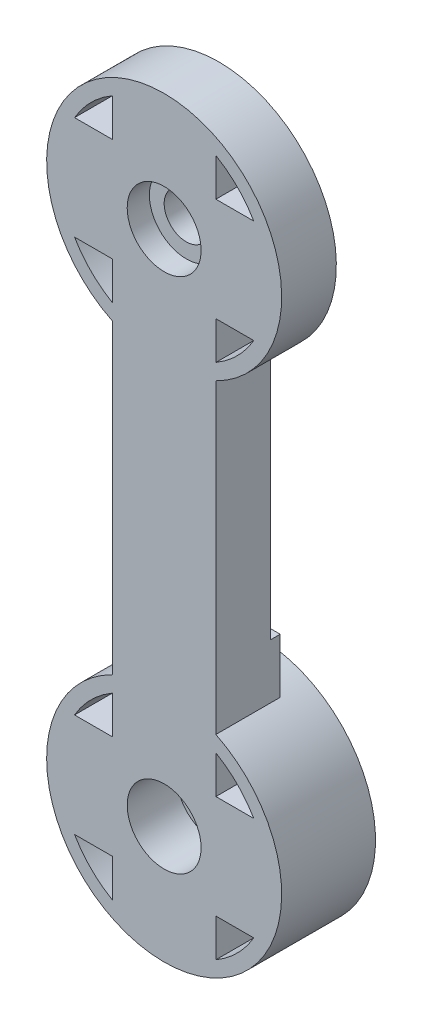
from build123d import *
from build123d.topology import SkipClean

# Parameters (mm, degrees)
SKETCH1_R               = 1.5
BOSS_EXTRUDE4_DEPTH     = 3
BOSS_EXTRUDE5_START     = 3
SKETCH3_R               = 7.95
SKETCH3_R_2             = 1.5
BOSS_EXTRUDE5_DEPTH     = 3
SKETCH4_R               = 2.5
CUT_EXTRUDE1_DEPTH      = 1.5
SKETCH5_R               = 7
CUT_EXTRUDE2_DEPTH      = 2
SKETCH6_R               = 7.95
CUT_EXTRUDE3_DEPTH      = 1
SKETCH7_R               = 2.5
CUT_EXTRUDE4_DEPTH      = 1.85
BOSS_EXTRUDE6_START     = 0.7
SKETCH8_R               = 7.95
SKETCH8_R_2             = 7
BOSS_EXTRUDE6_DEPTH     = 0.7
BOSS_EXTRUDE8_START     = 0.7
SKETCH9_R               = 7.95
SKETCH9_R_2             = 1.5
BOSS_EXTRUDE8_DEPTH     = 0.7
BOSS_EXTRUDE9_START     = 0.7
BOSS_EXTRUDE9_DEPTH     = 0.7
CUT_EXTRUDE5_DEPTH      = 45.603755447
CUT_EXTRUDE5_DEPTH_BACK = 45.603755447
SKETCH11_W              = 3
SKETCH11_H              = 15.9
SKETCH11_W_2            = 2
BOSS_EXTRUDE10_START    = 0.65
BOSS_EXTRUDE10_DEPTH    = 0.65
BOSS_EXTRUDE11_START    = 2.65
SKETCH13_R              = 7.95
SKETCH13_R_2            = 1.5
BOSS_EXTRUDE11_DEPTH    = 2.65


with BuildPart() as part:
    # Sketch1 → Boss-Extrude4 (new body)
    with BuildSketch(Plane.XY):
        with BuildLine():
            Line((-3.5, -7.138101989), (-3.5, -27.861898011))
            ThreePointArc((-3.5, -27.861898011), (0, -42.95), (3.5, -27.861898011))
            Line((3.5, -27.861898011), (3.5, -7.138101989))
            ThreePointArc((3.5, -7.138101989), (0, 7.95), (-3.5, -7.138101989))
        make_face()
        with BuildLine():
            Line((-3.5, 6.062177826), (-3.5, 3.5))
            Line((-3.5, 3.5), (-6.062177826, 3.5))
            ThreePointArc((-6.062177826, 3.5), (-4.949747468, 4.949747468), (-3.5, 6.062177826))
        make_face(mode=Mode.SUBTRACT)
        with BuildLine():
            Line((3.5, 3.5), (3.5, 6.062177826))
            ThreePointArc((3.5, 6.062177826), (4.949747468, 4.949747468), (6.062177826, 3.5))
            Line((6.062177826, 3.5), (3.5, 3.5))
        make_face(mode=Mode.SUBTRACT)
        Circle(SKETCH1_R, mode=Mode.SUBTRACT)
        with BuildLine():
            Line((-6.062177826, -3.5), (-3.5, -3.5))
            Line((-3.5, -3.5), (-3.5, -6.062177826))
            ThreePointArc((-3.5, -6.062177826), (-4.949747468, -4.949747468), (-6.062177826, -3.5))
        make_face(mode=Mode.SUBTRACT)
        with BuildLine():
            Line((3.5, -3.5), (6.062177826, -3.5))
            ThreePointArc((6.062177826, -3.5), (4.949747468, -4.949747468), (3.5, -6.062177826))
            Line((3.5, -6.062177826), (3.5, -3.5))
        make_face(mode=Mode.SUBTRACT)
        with BuildLine():
            ThreePointArc((3.5, -28.937822174), (4.949747468, -30.050252532), (6.062177826, -31.5))
            Line((6.062177826, -31.5), (3.5, -31.5))
            Line((3.5, -31.5), (3.5, -28.937822174))
        make_face(mode=Mode.SUBTRACT)
        with BuildLine():
            Line((-3.5, -28.937822174), (-3.5, -31.5))
            Line((-3.5, -31.5), (-6.062177826, -31.5))
            ThreePointArc((-6.062177826, -31.5), (-4.949747468, -30.050252532), (-3.5, -28.937822174))
        make_face(mode=Mode.SUBTRACT)
        with BuildLine():
            ThreePointArc((-3.5, -41.062177826), (-4.949747468, -39.949747468), (-6.062177826, -38.5))
            Line((-6.062177826, -38.5), (-3.5, -38.5))
            Line((-3.5, -38.5), (-3.5, -41.062177826))
        make_face(mode=Mode.SUBTRACT)
        with BuildLine():
            ThreePointArc((6.062177826, -38.5), (4.949747468, -39.949747468), (3.5, -41.062177826))
            Line((3.5, -41.062177826), (3.5, -38.5))
            Line((3.5, -38.5), (6.062177826, -38.5))
        make_face(mode=Mode.SUBTRACT)
        with Locations((0, -35)):
            Circle(SKETCH1_R, mode=Mode.SUBTRACT)
    extrude(amount=BOSS_EXTRUDE4_DEPTH)

    # Sketch3 → Boss-Extrude5 (add)
    # profile 1 of 2: a face of its own
    with SkipClean():  # the faces are left unmerged after this step: merging them gives an invalid solid
        with BuildSketch(Plane(origin=(0, 0, 0), x_dir=(-1, 0, 0), z_dir=(0, 0, -1)).offset(BOSS_EXTRUDE5_START)):
            Circle(SKETCH3_R)
            with BuildLine():
                Line((3.5, 3.5), (3.5, 6.062177826))
                ThreePointArc((3.5, 6.062177826), (4.949747468, 4.949747468), (6.062177826, 3.5))
                Line((6.062177826, 3.5), (3.5, 3.5))
            make_face(mode=Mode.SUBTRACT)
            with BuildLine():
                Line((3.5, -3.5), (6.062177826, -3.5))
                ThreePointArc((6.062177826, -3.5), (4.949747468, -4.949747468), (3.5, -6.062177826))
                Line((3.5, -6.062177826), (3.5, -3.5))
            make_face(mode=Mode.SUBTRACT)
            with BuildLine():
                Line((-3.5, -3.5), (-3.5, -6.062177826))
                ThreePointArc((-3.5, -6.062177826), (-4.949747468, -4.949747468), (-6.062177826, -3.5))
                Line((-6.062177826, -3.5), (-3.5, -3.5))
            make_face(mode=Mode.SUBTRACT)
            with BuildLine():
                Line((-3.5, 3.5), (-6.062177826, 3.5))
                ThreePointArc((-6.062177826, 3.5), (-4.949747468, 4.949747468), (-3.5, 6.062177826))
                Line((-3.5, 6.062177826), (-3.5, 3.5))
            make_face(mode=Mode.SUBTRACT)
            Circle(SKETCH3_R_2, mode=Mode.SUBTRACT)
        # profile 2 of 2: a face of its own
        with BuildSketch(Plane(origin=(0, 0, 0), x_dir=(-1, 0, 0), z_dir=(0, 0, -1)).offset(BOSS_EXTRUDE5_START)):
            with Locations((0, -35)):
                Circle(SKETCH3_R)
            with BuildLine():
                Line((-3.5, -38.5), (-3.5, -41.062177826))
                ThreePointArc((-3.5, -41.062177826), (-4.949747468, -39.949747468), (-6.062177826, -38.5))
                Line((-6.062177826, -38.5), (-3.5, -38.5))
            make_face(mode=Mode.SUBTRACT)
            with BuildLine():
                Line((-3.5, -31.5), (-6.062177826, -31.5))
                ThreePointArc((-6.062177826, -31.5), (-4.949747468, -30.050252532), (-3.5, -28.937822174))
                Line((-3.5, -28.937822174), (-3.5, -31.5))
            make_face(mode=Mode.SUBTRACT)
            with BuildLine():
                Line((3.5, -31.5), (3.5, -28.937822174))
                ThreePointArc((3.5, -28.937822174), (4.949747468, -30.050252532), (6.062177826, -31.5))
                Line((6.062177826, -31.5), (3.5, -31.5))
            make_face(mode=Mode.SUBTRACT)
            with BuildLine():
                Line((3.5, -38.5), (6.062177826, -38.5))
                ThreePointArc((6.062177826, -38.5), (4.949747468, -39.949747468), (3.5, -41.062177826))
                Line((3.5, -41.062177826), (3.5, -38.5))
            make_face(mode=Mode.SUBTRACT)
            with Locations((0, -35)):
                Circle(SKETCH3_R_2, mode=Mode.SUBTRACT)
        extrude(amount=-BOSS_EXTRUDE5_DEPTH)

    # Sketch4 → Cut-Extrude1 (cut)
    with SkipClean():  # the faces are left unmerged after this step: merging them gives an invalid solid
        with BuildSketch(Plane.XY.offset(3)):
            with Locations((0, -35)):
                Circle(SKETCH4_R)
            Circle(SKETCH4_R)
        extrude(amount=-CUT_EXTRUDE1_DEPTH, mode=Mode.SUBTRACT)

    # Sketch5 → Cut-Extrude2 (cut)
    with SkipClean():  # the faces are left unmerged after this step: merging them gives an invalid solid
        with BuildSketch(Plane(origin=(0, 0, -3), x_dir=(-1, 0, 0), z_dir=(0, 0, -1))):
            Circle(SKETCH5_R)
        extrude(amount=-CUT_EXTRUDE2_DEPTH, mode=Mode.SUBTRACT)

    # Sketch6 → Cut-Extrude3 (cut)
    with SkipClean():  # the faces are left unmerged after this step: merging them gives an invalid solid
        with BuildSketch(Plane(origin=(0, 0, -3), x_dir=(-1, 0, 0), z_dir=(0, 0, -1))):
            with Locations((0, -35)):
                Circle(SKETCH6_R)
        extrude(amount=-CUT_EXTRUDE3_DEPTH, mode=Mode.SUBTRACT)

    # Sketch7 → Cut-Extrude4 (cut)
    with SkipClean():  # the faces are left unmerged after this step: merging them gives an invalid solid
        with BuildSketch(Plane.XY.offset(1.5)):
            with Locations((0, -35)):
                Circle(SKETCH7_R)
        extrude(amount=-CUT_EXTRUDE4_DEPTH, mode=Mode.SUBTRACT)

    # Sketch8 → Boss-Extrude6 (add)
    with BuildSketch(Plane(origin=(0, 0, -3), x_dir=(-1, 0, 0), z_dir=(0, 0, -1)).offset(BOSS_EXTRUDE6_START)):
        Circle(SKETCH8_R)
        Circle(SKETCH8_R_2, mode=Mode.SUBTRACT)
    extrude(amount=-BOSS_EXTRUDE6_DEPTH)

    # Sketch9 → Boss-Extrude8 (add)
    with SkipClean():  # the faces are left unmerged after this step: merging them gives an invalid solid
        with BuildSketch(Plane(origin=(0, 0, -2), x_dir=(-1, 0, 0), z_dir=(0, 0, -1)).offset(BOSS_EXTRUDE8_START)):
            with Locations((0, -35)):
                Circle(SKETCH9_R)
            with BuildLine():
                Line((3.5, -31.5), (3.5, -28.937822174))
                ThreePointArc((3.5, -28.937822174), (4.949747468, -30.050252532), (6.062177826, -31.5))
                Line((6.062177826, -31.5), (3.5, -31.5))
            make_face(mode=Mode.SUBTRACT)
            with BuildLine():
                Line((3.5, -38.5), (6.062177826, -38.5))
                ThreePointArc((6.062177826, -38.5), (4.949747468, -39.949747468), (3.5, -41.062177826))
                Line((3.5, -41.062177826), (3.5, -38.5))
            make_face(mode=Mode.SUBTRACT)
            with BuildLine():
                Line((-3.5, -38.5), (-3.5, -41.062177826))
                ThreePointArc((-3.5, -41.062177826), (-4.949747468, -39.949747468), (-6.062177826, -38.5))
                Line((-6.062177826, -38.5), (-3.5, -38.5))
            make_face(mode=Mode.SUBTRACT)
            with BuildLine():
                Line((-3.5, -31.5), (-6.062177826, -31.5))
                ThreePointArc((-6.062177826, -31.5), (-4.949747468, -30.050252532), (-3.5, -28.937822174))
                Line((-3.5, -28.937822174), (-3.5, -31.5))
            make_face(mode=Mode.SUBTRACT)
            with Locations((0, -35)):
                Circle(SKETCH9_R_2, mode=Mode.SUBTRACT)
        extrude(amount=-BOSS_EXTRUDE8_DEPTH)

    # Sketch10 → Boss-Extrude9 (add)
    with SkipClean():  # the faces are left unmerged after this step: merging them gives an invalid solid
        with BuildSketch(Plane(origin=(0, 0, 0), x_dir=(-1, 0, 0), z_dir=(0, 0, -1)).offset(BOSS_EXTRUDE9_START)):
            with BuildLine():
                ThreePointArc((3.5, -7.138101989), (0, -7.95), (-3.5, -7.138101989))
                Line((-3.5, -7.138101989), (-3.5, -27.861898011))
                ThreePointArc((-3.5, -27.861898011), (0, -27.05), (3.5, -27.861898011))
                Line((3.5, -27.861898011), (3.5, -7.138101989))
            make_face()
        extrude(amount=-BOSS_EXTRUDE9_DEPTH)

    # Sketch11 → Cut-Extrude5 (cut, two sides: drawn at the far end of the back side and taken through both)
    with SkipClean():  # the faces are left unmerged after this step: merging them gives an invalid solid
        with BuildSketch(Plane(origin=(3.5, 0, 0), x_dir=(0, 0, -1), z_dir=(1, 0, 0)).offset(-CUT_EXTRUDE5_DEPTH_BACK)):
            with Locations((2.2, 0)):
                Rectangle(SKETCH11_W, SKETCH11_H)
            with Locations((1.7, -35)):
                Rectangle(SKETCH11_W_2, SKETCH11_H)
        extrude(amount=CUT_EXTRUDE5_DEPTH + CUT_EXTRUDE5_DEPTH_BACK, mode=Mode.SUBTRACT)

    # Sketch12 → Boss-Extrude10 (add)
    with SkipClean():  # the faces are left unmerged after this step: merging them gives an invalid solid
        with BuildSketch(Plane(origin=(0, 0, -0.7), x_dir=(-1, 0, 0), z_dir=(0, 0, -1)).offset(BOSS_EXTRUDE10_START)):
            with BuildLine():
                Line((-3.5, -24.161898011), (-3.5, -27.861898011))
                ThreePointArc((-3.5, -27.861898011), (0, -27.05), (3.5, -27.861898011))
                Line((3.5, -27.861898011), (3.5, -24.161898011))
                Line((3.5, -24.161898011), (-3.5, -24.161898011))
            make_face()
        extrude(amount=-BOSS_EXTRUDE10_DEPTH)

    # Sketch13 → Boss-Extrude11 (add)
    with SkipClean():  # the faces are left unmerged after this step: merging them gives an invalid solid
        with BuildSketch(Plane(origin=(0, 0, -0.7), x_dir=(-1, 0, 0), z_dir=(0, 0, -1)).offset(BOSS_EXTRUDE11_START)):
            with Locations((0, -35)):
                Circle(SKETCH13_R)
            with BuildLine():
                Line((-3.5, -31.5), (-6.062177826, -31.5))
                ThreePointArc((-6.062177826, -31.5), (-4.949747468, -30.050252532), (-3.5, -28.937822174))
                Line((-3.5, -28.937822174), (-3.5, -31.5))
            make_face(mode=Mode.SUBTRACT)
            with BuildLine():
                Line((3.5, -31.5), (3.5, -28.937822174))
                ThreePointArc((3.5, -28.937822174), (4.949747468, -30.050252532), (6.062177826, -31.5))
                Line((6.062177826, -31.5), (3.5, -31.5))
            make_face(mode=Mode.SUBTRACT)
            with BuildLine():
                Line((3.5, -38.5), (6.062177826, -38.5))
                ThreePointArc((6.062177826, -38.5), (4.949747468, -39.949747468), (3.5, -41.062177826))
                Line((3.5, -41.062177826), (3.5, -38.5))
            make_face(mode=Mode.SUBTRACT)
            with BuildLine():
                Line((-3.5, -38.5), (-3.5, -41.062177826))
                ThreePointArc((-3.5, -41.062177826), (-4.949747468, -39.949747468), (-6.062177826, -38.5))
                Line((-6.062177826, -38.5), (-3.5, -38.5))
            make_face(mode=Mode.SUBTRACT)
            with Locations((0, -35)):
                Circle(SKETCH13_R_2, mode=Mode.SUBTRACT)
        extrude(amount=-BOSS_EXTRUDE11_DEPTH)


solid = part.part
